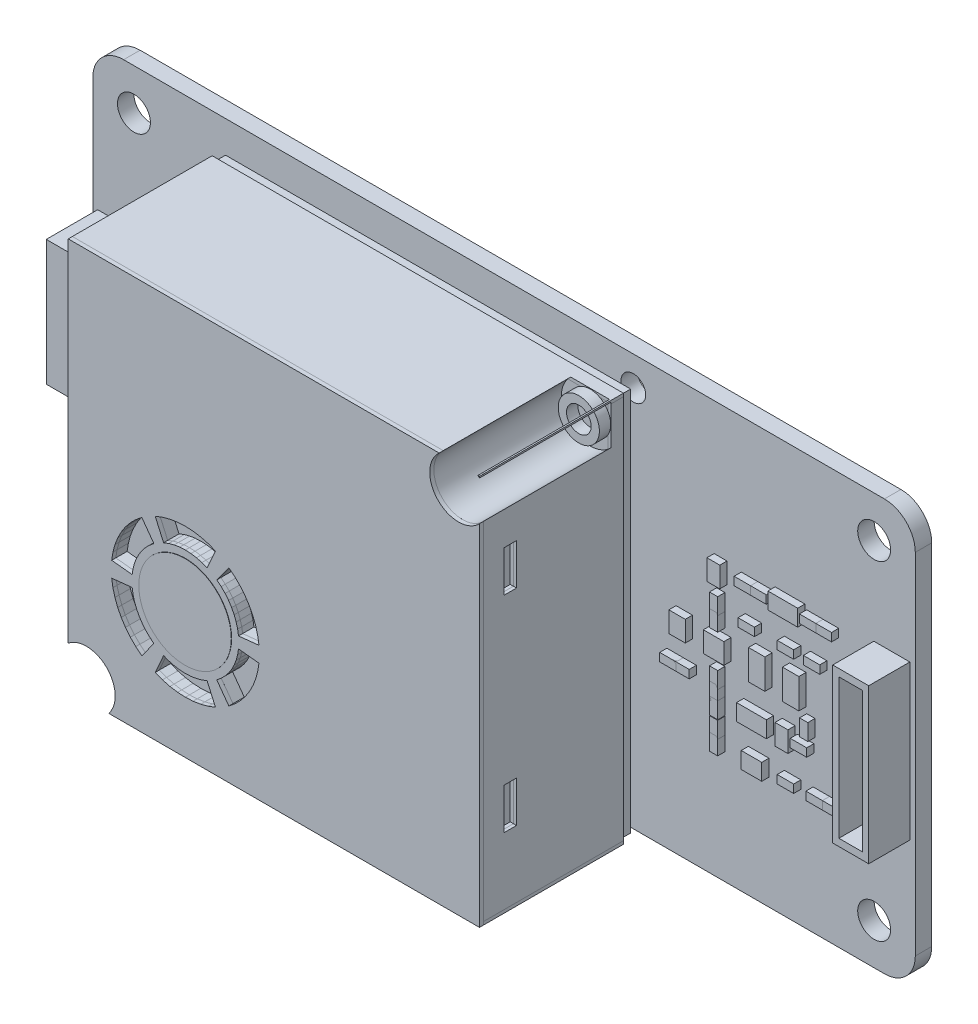
from build123d import *

# Parameters (mm, degrees)
ESQUISSE1_R                                  = 1.6
ESQUISSE1_R_2                                = 1.2
PCB_EAGLE_80X40_R3_EP_ESTIMEE_1_6_DEPTH      = 1.6
HM3301_CORPS_40X38X15_Z_ESTIME_START         = 3.6
ESQUISSE2_W                                  = 39.4
ESQUISSE2_H                                  = 37.4
HM3301_CORPS_40X38X15_Z_ESTIME_DEPTH         = 14.6
CAPOT_SUPERIEUR_EP_SIMPLIFIEE_START          = 18.2
ESQUISSE3_W                                  = 40
ESQUISSE3_H                                  = 38
CAPOT_SUPERIEUR_EP_SIMPLIFIEE_DEPTH          = 0.4
FLANCS_CAPOT_SIMPLIFIES_START                = 4.6
ESQUISSE4_W                                  = 40
ESQUISSE4_H                                  = 0.3
FLANCS_CAPOT_SIMPLIFIES_DEPTH                = 13.6
FLANCS_CAPOT_SIMPLIFIES_2_DEPTH              = 13.6
FACES_CAPOT_SIMPLIFIEES_START                = 4.6
ESQUISSE5_W                                  = 0.3
ESQUISSE5_H                                  = 37.4
FACES_CAPOT_SIMPLIFIEES_DEPTH                = 13.6
FACES_CAPOT_SIMPLIFIEES_2_DEPTH              = 13.6
DEGAGEMENTS_VIS_ESTIMES_START                = 18.6
ESQUISSE6_R                                  = 2.8
DEGAGEMENTS_VIS_ESTIMES_DEPTH                = 12.8
GRILLE_VENTILATEUR_ESTIMEE_START             = 18.6
GRILLE_VENTILATEUR_ESTIMEE_DEPTH             = 1.5
ETIQUETTE_VENTILATEUR_SIMPLIFIEE_START       = 18.6
ESQUISSE8_R                                  = 4.5
ETIQUETTE_VENTILATEUR_SIMPLIFIEE_DEPTH       = 0.03
FENTES_LATERALES_ESTIMEES_START              = 16.2
ESQUISSE9_W                                  = 3.5
ESQUISSE9_H                                  = 0.8
ESQUISSE9_W_2                                = 0.8
ESQUISSE9_H_2                                = 4
FENTES_LATERALES_ESTIMEES_DEPTH              = 1.2
FENTES_BASSES_ESTIMEES_START                 = 8.2
ESQUISSE10_W                                 = 3.5
ESQUISSE10_H                                 = 0.8
FENTES_BASSES_ESTIMEES_DEPTH                 = 1.2
GROVE_POSITION_EAGLE_HAUTEUR_ESTIMEE_START   = 1.6
ESQUISSE11_W                                 = 7.7
ESQUISSE11_H                                 = 12.2
GROVE_POSITION_EAGLE_HAUTEUR_ESTIMEE_DEPTH   = 5
OUVERTURE_GROVE_START                        = 5.9
ESQUISSE12_W                                 = 6.5
ESQUISSE12_H                                 = 10.6
OUVERTURE_GROVE_DEPTH                        = 3.5
BROCHES_GROVE_START                          = 3
ESQUISSE13_W                                 = 5.5
ESQUISSE13_H                                 = 0.5
BROCHES_GROVE_DEPTH                          = 0.5
BROCHES_GROVE_2_DEPTH                        = 0.5
BROCHES_GROVE_3_DEPTH                        = 0.5
BROCHES_GROVE_4_DEPTH                        = 0.5
CONNECTEUR_8P_POSITION_EAGLE_H_ESTIMEE_START = 1.6
ESQUISSE14_W                                 = 3.5
ESQUISSE14_H                                 = 15
CONNECTEUR_8P_POSITION_EAGLE_H_ESTIMEE_DEPTH = 4
CAVITE_8P_SIMPLIFIEE_START                   = 5.6
ESQUISSE15_W                                 = 2.3
ESQUISSE15_H                                 = 13.6
CAVITE_8P_SIMPLIFIEE_DEPTH                   = 2.7
TETES_VIS_SIMPLIFIEES_START                  = 5.8
ESQUISSE16_R                                 = 2
ESQUISSE16_R_2                               = 1.2
TETES_VIS_SIMPLIFIEES_DEPTH                  = 1.1
TETES_VIS_SIMPLIFIEES_2_DEPTH                = 1.1
COMPOSANT_EAGLE_1_START                      = 1.6
ESQUISSE17_W                                 = 0.8
ESQUISSE17_H                                 = 1.6
COMPOSANT_EAGLE_1_DEPTH                      = 0.7
COMPOSANT_EAGLE_2_START                      = 1.6
ESQUISSE18_W                                 = 2
ESQUISSE18_H                                 = 2
COMPOSANT_EAGLE_2_DEPTH                      = 0.7
COMPOSANT_EAGLE_3_START                      = 1.6
ESQUISSE19_W                                 = 1.6
ESQUISSE19_H                                 = 2
COMPOSANT_EAGLE_3_DEPTH                      = 0.7
COMPOSANT_EAGLE_4_START                      = 1.6
ESQUISSE20_W                                 = 1.6
ESQUISSE20_H                                 = 0.8
COMPOSANT_EAGLE_4_DEPTH                      = 0.7
COMPOSANT_EAGLE_5_START                      = 1.6
ESQUISSE21_W                                 = 1.6
ESQUISSE21_H                                 = 0.8
COMPOSANT_EAGLE_5_DEPTH                      = 0.7
COMPOSANT_EAGLE_6_START                      = 1.6
ESQUISSE22_W                                 = 0.8
ESQUISSE22_H                                 = 1.6
COMPOSANT_EAGLE_6_DEPTH                      = 0.7
COMPOSANT_EAGLE_7_START                      = 1.6
ESQUISSE23_W                                 = 0.8
ESQUISSE23_H                                 = 1.6
COMPOSANT_EAGLE_7_DEPTH                      = 0.7
COMPOSANT_EAGLE_8_START                      = 1.6
ESQUISSE24_W                                 = 0.8
ESQUISSE24_H                                 = 1.6
COMPOSANT_EAGLE_8_DEPTH                      = 0.7
COMPOSANT_EAGLE_9_START                      = 1.6
ESQUISSE25_W                                 = 2.9
ESQUISSE25_H                                 = 1.6
COMPOSANT_EAGLE_9_DEPTH                      = 0.7
COMPOSANT_EAGLE_10_START                     = 1.6
ESQUISSE26_W                                 = 2
ESQUISSE26_H                                 = 1.6
COMPOSANT_EAGLE_10_DEPTH                     = 0.7
COMPOSANT_EAGLE_11_START                     = 1.6
ESQUISSE27_W                                 = 0.8
ESQUISSE27_H                                 = 1.6
COMPOSANT_EAGLE_11_DEPTH                     = 0.7
COMPOSANT_EAGLE_12_START                     = 1.6
ESQUISSE28_W                                 = 0.8
ESQUISSE28_H                                 = 1.6
COMPOSANT_EAGLE_12_DEPTH                     = 0.7
COMPOSANT_EAGLE_13_START                     = 1.6
ESQUISSE29_W                                 = 0.8
ESQUISSE29_H                                 = 1.6
COMPOSANT_EAGLE_13_DEPTH                     = 0.7
COMPOSANT_EAGLE_14_START                     = 1.6
ESQUISSE30_W                                 = 1.6
ESQUISSE30_H                                 = 0.8
COMPOSANT_EAGLE_14_DEPTH                     = 0.7
COMPOSANT_EAGLE_15_START                     = 1.6
ESQUISSE31_W                                 = 1.6
ESQUISSE31_H                                 = 0.8
COMPOSANT_EAGLE_15_DEPTH                     = 0.7
COMPOSANT_EAGLE_16_START                     = 1.6
ESQUISSE32_W                                 = 1.25
ESQUISSE32_H                                 = 2
COMPOSANT_EAGLE_16_DEPTH                     = 0.7
COMPOSANT_EAGLE_17_START                     = 1.6
ESQUISSE33_W                                 = 1.6
ESQUISSE33_H                                 = 0.8
COMPOSANT_EAGLE_17_DEPTH                     = 0.7
COMPOSANT_EAGLE_18_START                     = 1.6
ESQUISSE34_W                                 = 0.8
ESQUISSE34_H                                 = 1.6
COMPOSANT_EAGLE_18_DEPTH                     = 0.7
COMPOSANT_EAGLE_19_START                     = 1.6
ESQUISSE35_W                                 = 1.6
ESQUISSE35_H                                 = 0.8
COMPOSANT_EAGLE_19_DEPTH                     = 0.7
COMPOSANT_EAGLE_20_START                     = 1.6
ESQUISSE36_W                                 = 1.25
ESQUISSE36_H                                 = 2
COMPOSANT_EAGLE_20_DEPTH                     = 0.7
COMPOSANT_EAGLE_21_START                     = 1.6
ESQUISSE37_W                                 = 2.9
ESQUISSE37_H                                 = 1.6
COMPOSANT_EAGLE_21_DEPTH                     = 0.7
COMPOSANT_EAGLE_22_START                     = 1.6
ESQUISSE38_W                                 = 1.6
ESQUISSE38_H                                 = 0.8
COMPOSANT_EAGLE_22_DEPTH                     = 0.7
COMPOSANT_EAGLE_23_START                     = 1.6
ESQUISSE39_W                                 = 1.6
ESQUISSE39_H                                 = 0.8
COMPOSANT_EAGLE_23_DEPTH                     = 0.7
COMPOSANT_EAGLE_24_START                     = 1.6
ESQUISSE40_W                                 = 1.6
ESQUISSE40_H                                 = 0.8
COMPOSANT_EAGLE_24_DEPTH                     = 0.7
COMPOSANT_EAGLE_25_START                     = 1.6
ESQUISSE41_W                                 = 1.6
ESQUISSE41_H                                 = 0.8
COMPOSANT_EAGLE_25_DEPTH                     = 0.7
COMPOSANT_EAGLE_26_START                     = 1.6
ESQUISSE42_W                                 = 1.6
ESQUISSE42_H                                 = 2.9
COMPOSANT_EAGLE_26_DEPTH                     = 0.7
COMPOSANT_EAGLE_27_START                     = 1.6
ESQUISSE43_W                                 = 1.6
ESQUISSE43_H                                 = 2.9
COMPOSANT_EAGLE_27_DEPTH                     = 0.7
COMPOSANT_EAGLE_28_START                     = 1.6
ESQUISSE44_W                                 = 1.6
ESQUISSE44_H                                 = 0.8
COMPOSANT_EAGLE_28_DEPTH                     = 0.7
COMPOSANT_EAGLE_29_START                     = 1.6
ESQUISSE45_W                                 = 1.6
ESQUISSE45_H                                 = 0.8
COMPOSANT_EAGLE_29_DEPTH                     = 0.7
COMPOSANT_EAGLE_30_START                     = 1.6
ESQUISSE46_W                                 = 1.6
ESQUISSE46_H                                 = 0.8
COMPOSANT_EAGLE_30_DEPTH                     = 0.7


with BuildPart() as part:
    # Esquisse1 → PCB_Eagle_80x40_R3_ep_ESTIMEE_1_6 (new body)
    with BuildSketch(Plane.XY):
        with BuildLine():
            Line((-37, -20), (37, -20))
            ThreePointArc((37, -20), (39.121320344, -19.121320344), (40, -17))
            Line((40, -17), (40, 17))
            ThreePointArc((40, 17), (39.121320344, 19.121320344), (37, 20))
            Line((37, 20), (-37, 20))
            ThreePointArc((-37, 20), (-39.121320344, 19.121320344), (-40, 17))
            Line((-40, 17), (-40, -17))
            ThreePointArc((-40, -17), (-39.121320344, -19.121320344), (-37, -20))
        make_face()
        with Locations((-36, -16)):
            Circle(ESQUISSE1_R, mode=Mode.SUBTRACT)
        with Locations((-36, 16)):
            Circle(ESQUISSE1_R, mode=Mode.SUBTRACT)
        with Locations((36, -16)):
            Circle(ESQUISSE1_R, mode=Mode.SUBTRACT)
        with Locations((36, 16)):
            Circle(ESQUISSE1_R, mode=Mode.SUBTRACT)
        with Locations((-23.622, -17.018)):
            Circle(ESQUISSE1_R_2, mode=Mode.SUBTRACT)
        with Locations((12.573, 17.145)):
            Circle(ESQUISSE1_R_2, mode=Mode.SUBTRACT)
    extrude(amount=PCB_EAGLE_80X40_R3_EP_ESTIMEE_1_6_DEPTH)


with BuildPart() as body_2:
    # Esquisse2 → HM3301_corps_40x38x15_Z_estime (new body)
    with BuildSketch(Plane.XY.offset(HM3301_CORPS_40X38X15_Z_ESTIME_START)):
        with Locations((-5.389, 0.213)):
            Rectangle(ESQUISSE2_W, ESQUISSE2_H)
    extrude(amount=HM3301_CORPS_40X38X15_Z_ESTIME_DEPTH)


with BuildPart() as body_3:
    # Esquisse3 → Capot_superieur_ep_simplifiee (new body)
    with BuildSketch(Plane.XY.offset(CAPOT_SUPERIEUR_EP_SIMPLIFIEE_START)):
        with Locations((-5.389, 0.213)):
            Rectangle(ESQUISSE3_W, ESQUISSE3_H)
    extrude(amount=CAPOT_SUPERIEUR_EP_SIMPLIFIEE_DEPTH)


with BuildPart() as body_4:
    # Esquisse4 → Flancs_capot_simplifies (new body)
    with BuildSketch(Plane.XY.offset(FLANCS_CAPOT_SIMPLIFIES_START)):
        with Locations((-5.389, -18.637)):
            Rectangle(ESQUISSE4_W, ESQUISSE4_H)
    extrude(amount=FLANCS_CAPOT_SIMPLIFIES_DEPTH)


with BuildPart() as body_5:
    # Esquisse4 → Flancs_capot_simplifies 2 (new body)
    with BuildSketch(Plane.XY.offset(FLANCS_CAPOT_SIMPLIFIES_START)):
        with Locations((-5.389, 19.063)):
            Rectangle(ESQUISSE4_W, ESQUISSE4_H)
    extrude(amount=FLANCS_CAPOT_SIMPLIFIES_2_DEPTH)


with BuildPart() as body_6:
    # Esquisse5 → Faces_capot_simplifiees (new body)
    with BuildSketch(Plane.XY.offset(FACES_CAPOT_SIMPLIFIEES_START)):
        with Locations((-25.239, 0.213)):
            Rectangle(ESQUISSE5_W, ESQUISSE5_H)
    extrude(amount=FACES_CAPOT_SIMPLIFIEES_DEPTH)


with BuildPart() as body_7:
    # Esquisse5 → Faces_capot_simplifiees 2 (new body)
    with BuildSketch(Plane.XY.offset(FACES_CAPOT_SIMPLIFIEES_START)):
        with Locations((14.461, 0.213)):
            Rectangle(ESQUISSE5_W, ESQUISSE5_H)
    extrude(amount=FACES_CAPOT_SIMPLIFIEES_2_DEPTH)


with BuildPart() as degagements_vis_estimes_tool:
    # Esquisse6 → Degagements_vis_ESTIMES (new body)
    with BuildSketch(Plane.XY.offset(DEGAGEMENTS_VIS_ESTIMES_START)):
        with Locations((-23.622, -17.018)):
            Circle(ESQUISSE6_R)
        with Locations((12.573, 17.145)):
            Circle(ESQUISSE6_R)
    extrude(amount=-DEGAGEMENTS_VIS_ESTIMES_DEPTH)


with BuildPart() as body_2_1:
    add(body_2.part)

    # Degagements_vis_ESTIMES: cut by degagements_vis_estimes_tool
    add(degagements_vis_estimes_tool.part, mode=Mode.SUBTRACT)


with BuildPart() as body_3_1:
    add(body_3.part)

    # Degagements_vis_ESTIMES: cut by degagements_vis_estimes_tool
    add(degagements_vis_estimes_tool.part, mode=Mode.SUBTRACT)


with BuildPart() as body_4_1:
    add(body_4.part)

    # Degagements_vis_ESTIMES: cut by degagements_vis_estimes_tool
    add(degagements_vis_estimes_tool.part, mode=Mode.SUBTRACT)


with BuildPart() as body_5_1:
    add(body_5.part)

    # Degagements_vis_ESTIMES: cut by degagements_vis_estimes_tool
    add(degagements_vis_estimes_tool.part, mode=Mode.SUBTRACT)


with BuildPart() as body_6_1:
    add(body_6.part)

    # Degagements_vis_ESTIMES: cut by degagements_vis_estimes_tool
    add(degagements_vis_estimes_tool.part, mode=Mode.SUBTRACT)


with BuildPart() as body_7_1:
    add(body_7.part)

    # Degagements_vis_ESTIMES: cut by degagements_vis_estimes_tool
    add(degagements_vis_estimes_tool.part, mode=Mode.SUBTRACT)


with BuildPart() as grille_ventilateur_estimee_tool:
    # Esquisse7 → Grille_ventilateur_ESTIMEE (new body)
    with BuildSketch(Plane.XY.offset(GRILLE_VENTILATEUR_ESTIMEE_START)):
        Polygon((-6.839442353, -5.747395064), (-6.957337275, -5.003035826), (-7.152393083, -4.275077641), (-7.422472705, -3.57149617), (-7.764617093, -2.9), (-8.175077641, -2.267946183), (-8.649357257, -1.682259634), (-9.182259634, -1.149357257), (-9.767946183, -0.675077641), (-10.943516688, -2.293111629), (-10.520520847, -2.635646908), (-10.135646908, -3.020520847), (-9.793111629, -3.443516688), (-9.4966679, -3.9), (-9.24956362, -4.384969456), (-9.054506115, -4.893111629), (-8.913632476, -5.418859208), (-8.828486144, -5.956451991), align=None)
        Polygon((-11.07149617, 0.077527295), (-11.775077641, 0.347606917), (-12.503035826, 0.542662725), (-13.247395064, 0.660557647), (-14, 0.7), (-14.752604936, 0.660557647), (-15.496964174, 0.542662725), (-16.224922359, 0.347606917), (-16.92850383, 0.077527295), (-16.115030544, -1.74956362), (-15.606888371, -1.554506115), (-15.081140792, -1.413632476), (-14.543548009, -1.328486144), (-14, -1.3), (-13.456451991, -1.328486144), (-12.918859208, -1.413632476), (-12.393111629, -1.554506115), (-11.884969456, -1.74956362), align=None)
        Polygon((-18.232053817, -0.675077641), (-18.817740366, -1.149357257), (-19.350642743, -1.682259634), (-19.824922359, -2.267946183), (-20.235382907, -2.9), (-20.577527295, -3.57149617), (-20.847606917, -4.275077641), (-21.042662725, -5.003035826), (-21.160557647, -5.747395064), (-19.171513856, -5.956451991), (-19.086367524, -5.418859208), (-18.945493885, -4.893111629), (-18.75043638, -4.384969456), (-18.5033321, -3.9), (-18.206888371, -3.443516688), (-17.864353092, -3.020520847), (-17.479479153, -2.635646908), (-17.056483312, -2.293111629), align=None)
        Polygon((-21.160557647, -7.252604936), (-21.042662725, -7.996964174), (-20.847606917, -8.724922359), (-20.577527295, -9.42850383), (-20.235382907, -10.1), (-19.824922359, -10.732053817), (-19.350642743, -11.317740366), (-18.817740366, -11.850642743), (-18.232053817, -12.324922359), (-17.056483312, -10.706888371), (-17.479479153, -10.364353092), (-17.864353092, -9.979479153), (-18.206888371, -9.556483312), (-18.5033321, -9.1), (-18.75043638, -8.615030544), (-18.945493885, -8.106888371), (-19.086367524, -7.581140792), (-19.171513856, -7.043548009), align=None)
        Polygon((-16.92850383, -13.077527295), (-16.224922359, -13.347606917), (-15.496964174, -13.542662725), (-14.752604936, -13.660557647), (-14, -13.7), (-13.247395064, -13.660557647), (-12.503035826, -13.542662725), (-11.775077641, -13.347606917), (-11.07149617, -13.077527295), (-11.884969456, -11.25043638), (-12.393111629, -11.445493885), (-12.918859208, -11.586367524), (-13.456451991, -11.671513856), (-14, -11.7), (-14.543548009, -11.671513856), (-15.081140792, -11.586367524), (-15.606888371, -11.445493885), (-16.115030544, -11.25043638), align=None)
        Polygon((-9.767946183, -12.324922359), (-9.182259634, -11.850642743), (-8.649357257, -11.317740366), (-8.175077641, -10.732053817), (-7.764617093, -10.1), (-7.422472705, -9.42850383), (-7.152393083, -8.724922359), (-6.957337275, -7.996964174), (-6.839442353, -7.252604936), (-8.828486144, -7.043548009), (-8.913632476, -7.581140792), (-9.054506115, -8.106888371), (-9.24956362, -8.615030544), (-9.4966679, -9.1), (-9.793111629, -9.556483312), (-10.135646908, -9.979479153), (-10.520520847, -10.364353092), (-10.943516688, -10.706888371), align=None)
    extrude(amount=-GRILLE_VENTILATEUR_ESTIMEE_DEPTH)


with BuildPart() as body_2_2:
    add(body_2_1.part)

    # Grille_ventilateur_ESTIMEE: cut by grille_ventilateur_estimee_tool
    add(grille_ventilateur_estimee_tool.part, mode=Mode.SUBTRACT)


with BuildPart() as body_3_2:
    add(body_3_1.part)

    # Grille_ventilateur_ESTIMEE: cut by grille_ventilateur_estimee_tool
    add(grille_ventilateur_estimee_tool.part, mode=Mode.SUBTRACT)


with BuildPart() as body_8:
    # Esquisse8 → Etiquette_ventilateur_simplifiee (new body)
    with BuildSketch(Plane.XY.offset(ETIQUETTE_VENTILATEUR_SIMPLIFIEE_START)):
        with Locations((-14, -6.5)):
            Circle(ESQUISSE8_R)
    extrude(amount=ETIQUETTE_VENTILATEUR_SIMPLIFIEE_DEPTH)


with BuildPart() as fentes_laterales_estimees_tool:
    # Esquisse9 → Fentes_laterales_ESTIMEES (new body)
    with BuildSketch(Plane.XY.offset(FENTES_LATERALES_ESTIMEES_START)):
        with Locations((-18.25, -18.6)):
            Rectangle(ESQUISSE9_W, ESQUISSE9_H)
        with Locations((7.75, -18.6)):
            Rectangle(ESQUISSE9_W, ESQUISSE9_H)
        with Locations((14.4, -10)):
            Rectangle(ESQUISSE9_W_2, ESQUISSE9_H_2)
        with Locations((14.4, 10)):
            Rectangle(ESQUISSE9_W_2, ESQUISSE9_H_2)
    extrude(amount=-FENTES_LATERALES_ESTIMEES_DEPTH)


with BuildPart() as body_2_3:
    add(body_2_2.part)

    # Fentes_laterales_ESTIMEES: cut by fentes_laterales_estimees_tool
    add(fentes_laterales_estimees_tool.part, mode=Mode.SUBTRACT)


with BuildPart() as body_4_2:
    add(body_4_1.part)

    # Fentes_laterales_ESTIMEES: cut by fentes_laterales_estimees_tool
    add(fentes_laterales_estimees_tool.part, mode=Mode.SUBTRACT)


with BuildPart() as body_7_2:
    add(body_7_1.part)

    # Fentes_laterales_ESTIMEES: cut by fentes_laterales_estimees_tool
    add(fentes_laterales_estimees_tool.part, mode=Mode.SUBTRACT)


with BuildPart() as fentes_basses_estimees_tool:
    # Esquisse10 → Fentes_basses_ESTIMEES (new body)
    with BuildSketch(Plane.XY.offset(FENTES_BASSES_ESTIMEES_START)):
        with Locations((-18.25, -18.6)):
            Rectangle(ESQUISSE10_W, ESQUISSE10_H)
        with Locations((7.75, -18.6)):
            Rectangle(ESQUISSE10_W, ESQUISSE10_H)
    extrude(amount=-FENTES_BASSES_ESTIMEES_DEPTH)


with BuildPart() as body_2_4:
    add(body_2_3.part)

    # Fentes_basses_ESTIMEES: cut by fentes_basses_estimees_tool
    add(fentes_basses_estimees_tool.part, mode=Mode.SUBTRACT)


with BuildPart() as body_4_3:
    add(body_4_2.part)

    # Fentes_basses_ESTIMEES: cut by fentes_basses_estimees_tool
    add(fentes_basses_estimees_tool.part, mode=Mode.SUBTRACT)


with BuildPart() as body_9:
    # Esquisse11 → Grove_position_Eagle_hauteur_ESTIMEE (new body)
    with BuildSketch(Plane.XY.offset(GROVE_POSITION_EAGLE_HAUTEUR_ESTIMEE_START)):
        with Locations((-35.6776, 0)):
            Rectangle(ESQUISSE11_W, ESQUISSE11_H)
    extrude(amount=GROVE_POSITION_EAGLE_HAUTEUR_ESTIMEE_DEPTH)

    # Esquisse12 → Ouverture_Grove (cut)
    with BuildSketch(Plane.XY.offset(OUVERTURE_GROVE_START)):
        with Locations((-36.75, 0)):
            Rectangle(ESQUISSE12_W, ESQUISSE12_H)
    extrude(amount=-OUVERTURE_GROVE_DEPTH, mode=Mode.SUBTRACT)


with BuildPart() as body_10:
    # Esquisse13 → Broches_Grove (new body)
    with BuildSketch(Plane.XY.offset(BROCHES_GROVE_START)):
        with Locations((-35.75, -3)):
            Rectangle(ESQUISSE13_W, ESQUISSE13_H)
    extrude(amount=BROCHES_GROVE_DEPTH)


with BuildPart() as body_11:
    # Esquisse13 → Broches_Grove 2 (new body)
    with BuildSketch(Plane.XY.offset(BROCHES_GROVE_START)):
        with Locations((-35.75, -1)):
            Rectangle(ESQUISSE13_W, ESQUISSE13_H)
    extrude(amount=BROCHES_GROVE_2_DEPTH)


with BuildPart() as body_12:
    # Esquisse13 → Broches_Grove 3 (new body)
    with BuildSketch(Plane.XY.offset(BROCHES_GROVE_START)):
        with Locations((-35.75, 1)):
            Rectangle(ESQUISSE13_W, ESQUISSE13_H)
    extrude(amount=BROCHES_GROVE_3_DEPTH)


with BuildPart() as body_13:
    # Esquisse13 → Broches_Grove 4 (new body)
    with BuildSketch(Plane.XY.offset(BROCHES_GROVE_START)):
        with Locations((-35.75, 3)):
            Rectangle(ESQUISSE13_W, ESQUISSE13_H)
    extrude(amount=BROCHES_GROVE_4_DEPTH)


with BuildPart() as body_14:
    # Esquisse14 → Connecteur_8P_position_Eagle_H_ESTIMEE (new body)
    with BuildSketch(Plane.XY.offset(CONNECTEUR_8P_POSITION_EAGLE_H_ESTIMEE_START)):
        with Locations((37.719, 0)):
            Rectangle(ESQUISSE14_W, ESQUISSE14_H)
    extrude(amount=CONNECTEUR_8P_POSITION_EAGLE_H_ESTIMEE_DEPTH)

    # Esquisse15 → Cavite_8P_simplifiee (cut)
    with BuildSketch(Plane.XY.offset(CAVITE_8P_SIMPLIFIEE_START)):
        with Locations((37.719, 0)):
            Rectangle(ESQUISSE15_W, ESQUISSE15_H)
    extrude(amount=-CAVITE_8P_SIMPLIFIEE_DEPTH, mode=Mode.SUBTRACT)


with BuildPart() as body_15:
    # Esquisse16 → Tetes_vis_simplifiees (new body)
    with BuildSketch(Plane.XY.offset(TETES_VIS_SIMPLIFIEES_START)):
        with Locations((-23.622, -17.018)):
            Circle(ESQUISSE16_R)
        with Locations((-23.622, -17.018)):
            Circle(ESQUISSE16_R_2, mode=Mode.SUBTRACT)
    extrude(amount=TETES_VIS_SIMPLIFIEES_DEPTH)


with BuildPart() as body_16:
    # Esquisse16 → Tetes_vis_simplifiees 2 (new body)
    with BuildSketch(Plane.XY.offset(TETES_VIS_SIMPLIFIEES_START)):
        with Locations((12.573, 17.145)):
            Circle(ESQUISSE16_R)
        with Locations((12.573, 17.145)):
            Circle(ESQUISSE16_R_2, mode=Mode.SUBTRACT)
    extrude(amount=TETES_VIS_SIMPLIFIEES_2_DEPTH)


with BuildPart() as body_17:
    # Esquisse17 → Composant_Eagle_1 (new body)
    with BuildSketch(Plane.XY.offset(COMPOSANT_EAGLE_1_START)):
        with Locations((21.082, -2.667)):
            Rectangle(ESQUISSE17_W, ESQUISSE17_H)
    extrude(amount=COMPOSANT_EAGLE_1_DEPTH)


with BuildPart() as body_18:
    # Esquisse18 → Composant_Eagle_2 (new body)
    with BuildSketch(Plane.XY.offset(COMPOSANT_EAGLE_2_START)):
        with Locations((21.082, -0.127)):
            Rectangle(ESQUISSE18_W, ESQUISSE18_H)
    extrude(amount=COMPOSANT_EAGLE_2_DEPTH)


with BuildPart() as body_19:
    # Esquisse19 → Composant_Eagle_3 (new body)
    with BuildSketch(Plane.XY.offset(COMPOSANT_EAGLE_3_START)):
        with Locations((17.526, -0.127)):
            Rectangle(ESQUISSE19_W, ESQUISSE19_H)
    extrude(amount=COMPOSANT_EAGLE_3_DEPTH)


with BuildPart() as body_20:
    # Esquisse20 → Composant_Eagle_4 (new body)
    with BuildSketch(Plane.XY.offset(COMPOSANT_EAGLE_4_START)):
        with Locations((17.907, -3.556)):
            Rectangle(ESQUISSE20_W, ESQUISSE20_H)
    extrude(amount=COMPOSANT_EAGLE_4_DEPTH)


with BuildPart() as body_21:
    # Esquisse21 → Composant_Eagle_5 (new body)
    with BuildSketch(Plane.XY.offset(COMPOSANT_EAGLE_5_START)):
        with Locations((16.637, -3.556)):
            Rectangle(ESQUISSE21_W, ESQUISSE21_H)
    extrude(amount=COMPOSANT_EAGLE_5_DEPTH)


with BuildPart() as body_22:
    # Esquisse22 → Composant_Eagle_6 (new body)
    with BuildSketch(Plane.XY.offset(COMPOSANT_EAGLE_6_START)):
        with Locations((21.082, 2.159)):
            Rectangle(ESQUISSE22_W, ESQUISSE22_H)
    extrude(amount=COMPOSANT_EAGLE_6_DEPTH)


with BuildPart() as body_23:
    # Esquisse23 → Composant_Eagle_7 (new body)
    with BuildSketch(Plane.XY.offset(COMPOSANT_EAGLE_7_START)):
        with Locations((21.082, -3.937)):
            Rectangle(ESQUISSE23_W, ESQUISSE23_H)
    extrude(amount=COMPOSANT_EAGLE_7_DEPTH)


with BuildPart() as body_24:
    # Esquisse24 → Composant_Eagle_8 (new body)
    with BuildSketch(Plane.XY.offset(COMPOSANT_EAGLE_8_START)):
        with Locations((21.082, 3.556)):
            Rectangle(ESQUISSE24_W, ESQUISSE24_H)
    extrude(amount=COMPOSANT_EAGLE_8_DEPTH)


with BuildPart() as body_25:
    # Esquisse25 → Composant_Eagle_9 (new body)
    with BuildSketch(Plane.XY.offset(COMPOSANT_EAGLE_9_START)):
        with Locations((24.765, -4.445)):
            Rectangle(ESQUISSE25_W, ESQUISSE25_H)
    extrude(amount=COMPOSANT_EAGLE_9_DEPTH)


with BuildPart() as body_26:
    # Esquisse26 → Composant_Eagle_10 (new body)
    with BuildSketch(Plane.XY.offset(COMPOSANT_EAGLE_10_START)):
        with Locations((24.765, -8.255)):
            Rectangle(ESQUISSE26_W, ESQUISSE26_H)
    extrude(amount=COMPOSANT_EAGLE_10_DEPTH)


with BuildPart() as body_27:
    # Esquisse27 → Composant_Eagle_11 (new body)
    with BuildSketch(Plane.XY.offset(COMPOSANT_EAGLE_11_START)):
        with Locations((21.082, -5.207)):
            Rectangle(ESQUISSE27_W, ESQUISSE27_H)
    extrude(amount=COMPOSANT_EAGLE_11_DEPTH)


with BuildPart() as body_28:
    # Esquisse28 → Composant_Eagle_12 (new body)
    with BuildSketch(Plane.XY.offset(COMPOSANT_EAGLE_12_START)):
        with Locations((21.082, -8.255)):
            Rectangle(ESQUISSE28_W, ESQUISSE28_H)
    extrude(amount=COMPOSANT_EAGLE_12_DEPTH)


with BuildPart() as body_29:
    # Esquisse29 → Composant_Eagle_13 (new body)
    with BuildSketch(Plane.XY.offset(COMPOSANT_EAGLE_13_START)):
        with Locations((21.082, -6.858)):
            Rectangle(ESQUISSE29_W, ESQUISSE29_H)
    extrude(amount=COMPOSANT_EAGLE_13_DEPTH)


with BuildPart() as body_30:
    # Esquisse30 → Composant_Eagle_14 (new body)
    with BuildSketch(Plane.XY.offset(COMPOSANT_EAGLE_14_START)):
        with Locations((32.385, -8.128)):
            Rectangle(ESQUISSE30_W, ESQUISSE30_H)
    extrude(amount=COMPOSANT_EAGLE_14_DEPTH)


with BuildPart() as body_31:
    # Esquisse31 → Composant_Eagle_15 (new body)
    with BuildSketch(Plane.XY.offset(COMPOSANT_EAGLE_15_START)):
        with Locations((30.861, -8.128)):
            Rectangle(ESQUISSE31_W, ESQUISSE31_H)
    extrude(amount=COMPOSANT_EAGLE_15_DEPTH)


with BuildPart() as body_32:
    # Esquisse32 → Composant_Eagle_16 (new body)
    with BuildSketch(Plane.XY.offset(COMPOSANT_EAGLE_16_START)):
        with Locations((27.686, -4.445)):
            Rectangle(ESQUISSE32_W, ESQUISSE32_H)
    extrude(amount=COMPOSANT_EAGLE_16_DEPTH)


with BuildPart() as body_33:
    # Esquisse33 → Composant_Eagle_17 (new body)
    with BuildSketch(Plane.XY.offset(COMPOSANT_EAGLE_17_START)):
        with Locations((29.337, -4.445)):
            Rectangle(ESQUISSE33_W, ESQUISSE33_H)
    extrude(amount=COMPOSANT_EAGLE_17_DEPTH)


with BuildPart() as body_34:
    # Esquisse34 → Composant_Eagle_18 (new body)
    with BuildSketch(Plane.XY.offset(COMPOSANT_EAGLE_18_START)):
        with Locations((29.845, -2.667)):
            Rectangle(ESQUISSE34_W, ESQUISSE34_H)
    extrude(amount=COMPOSANT_EAGLE_18_DEPTH)


with BuildPart() as body_35:
    # Esquisse35 → Composant_Eagle_19 (new body)
    with BuildSketch(Plane.XY.offset(COMPOSANT_EAGLE_19_START)):
        with Locations((28.067, -8.128)):
            Rectangle(ESQUISSE35_W, ESQUISSE35_H)
    extrude(amount=COMPOSANT_EAGLE_19_DEPTH)


with BuildPart() as body_36:
    # Esquisse36 → Composant_Eagle_20 (new body)
    with BuildSketch(Plane.XY.offset(COMPOSANT_EAGLE_20_START)):
        with Locations((21.058, 6.115)):
            Rectangle(ESQUISSE36_W, ESQUISSE36_H)
    extrude(amount=COMPOSANT_EAGLE_20_DEPTH)


with BuildPart() as body_37:
    # Esquisse37 → Composant_Eagle_21 (new body)
    with BuildSketch(Plane.XY.offset(COMPOSANT_EAGLE_21_START)):
        with Locations((27.813, 6.477)):
            Rectangle(ESQUISSE37_W, ESQUISSE37_H)
    extrude(amount=COMPOSANT_EAGLE_21_DEPTH)


with BuildPart() as body_38:
    # Esquisse38 → Composant_Eagle_22 (new body)
    with BuildSketch(Plane.XY.offset(COMPOSANT_EAGLE_22_START)):
        with Locations((25.4, 6.477)):
            Rectangle(ESQUISSE38_W, ESQUISSE38_H)
    extrude(amount=COMPOSANT_EAGLE_22_DEPTH)


with BuildPart() as body_39:
    # Esquisse39 → Composant_Eagle_23 (new body)
    with BuildSketch(Plane.XY.offset(COMPOSANT_EAGLE_23_START)):
        with Locations((23.876, 6.477)):
            Rectangle(ESQUISSE39_W, ESQUISSE39_H)
    extrude(amount=COMPOSANT_EAGLE_23_DEPTH)


with BuildPart() as body_40:
    # Esquisse40 → Composant_Eagle_24 (new body)
    with BuildSketch(Plane.XY.offset(COMPOSANT_EAGLE_24_START)):
        with Locations((31.75, 6.477)):
            Rectangle(ESQUISSE40_W, ESQUISSE40_H)
    extrude(amount=COMPOSANT_EAGLE_24_DEPTH)


with BuildPart() as body_41:
    # Esquisse41 → Composant_Eagle_25 (new body)
    with BuildSketch(Plane.XY.offset(COMPOSANT_EAGLE_25_START)):
        with Locations((30.226, 6.477)):
            Rectangle(ESQUISSE41_W, ESQUISSE41_H)
    extrude(amount=COMPOSANT_EAGLE_25_DEPTH)


with BuildPart() as body_42:
    # Esquisse42 → Composant_Eagle_26 (new body)
    with BuildSketch(Plane.XY.offset(COMPOSANT_EAGLE_26_START)):
        with Locations((28.575, 0.127)):
            Rectangle(ESQUISSE42_W, ESQUISSE42_H)
    extrude(amount=COMPOSANT_EAGLE_26_DEPTH)


with BuildPart() as body_43:
    # Esquisse43 → Composant_Eagle_27 (new body)
    with BuildSketch(Plane.XY.offset(COMPOSANT_EAGLE_27_START)):
        with Locations((25.273, 0.127)):
            Rectangle(ESQUISSE43_W, ESQUISSE43_H)
    extrude(amount=COMPOSANT_EAGLE_27_DEPTH)


with BuildPart() as body_44:
    # Esquisse44 → Composant_Eagle_28 (new body)
    with BuildSketch(Plane.XY.offset(COMPOSANT_EAGLE_28_START)):
        with Locations((28.067, 3.175)):
            Rectangle(ESQUISSE44_W, ESQUISSE44_H)
    extrude(amount=COMPOSANT_EAGLE_28_DEPTH)


with BuildPart() as body_45:
    # Esquisse45 → Composant_Eagle_29 (new body)
    with BuildSketch(Plane.XY.offset(COMPOSANT_EAGLE_29_START)):
        with Locations((24.257, 3.175)):
            Rectangle(ESQUISSE45_W, ESQUISSE45_H)
    extrude(amount=COMPOSANT_EAGLE_29_DEPTH)


with BuildPart() as body_46:
    # Esquisse46 → Composant_Eagle_30 (new body)
    with BuildSketch(Plane.XY.offset(COMPOSANT_EAGLE_30_START)):
        with Locations((30.607, 3.175)):
            Rectangle(ESQUISSE46_W, ESQUISSE46_H)
    extrude(amount=COMPOSANT_EAGLE_30_DEPTH)


solid = Compound([part.part, body_5_1.part, body_6_1.part, body_3_2.part, body_8.part, body_7_2.part, body_2_4.part, body_4_3.part, body_9.part, body_10.part, body_11.part, body_12.part, body_13.part, body_14.part, body_15.part, body_16.part, body_17.part, body_18.part, body_19.part, body_20.part, body_21.part, body_22.part, body_23.part, body_24.part, body_25.part, body_26.part, body_27.part, body_28.part, body_29.part, body_30.part, body_31.part, body_32.part, body_33.part, body_34.part, body_35.part, body_36.part, body_37.part, body_38.part, body_39.part, body_40.part, body_41.part, body_42.part, body_43.part, body_44.part, body_45.part, body_46.part])
